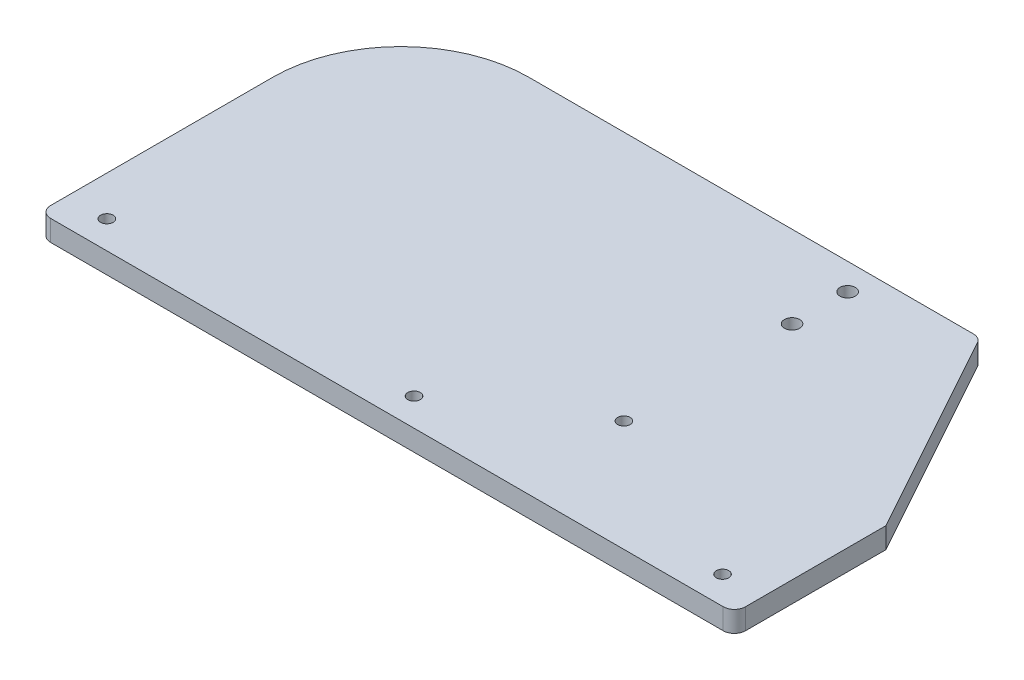
from build123d import *

# Parameters (mm, degrees)
SKETCH1_R           = 2.25
SKETCH1_R_2         = 2.75
BOSS_EXTRUDE1_DEPTH = 7.5


with BuildPart() as part:
    # Sketch1 → Boss-Extrude1 (new body)
    with BuildSketch(Plane(origin=(0, 0, 0), x_dir=(1, 0, 0), z_dir=(0, 1, 0))):
        with BuildLine():
            Line((-166.25, -10), (75.75, -10))
            ThreePointArc((75.75, -10), (78.578427125, -8.828427125), (79.75, -6))
            Line((79.75, -6), (79.75, 44.5))
            Line((79.75, 44.5), (39.252647377, 117.931699085))
            ThreePointArc((39.252647377, 117.931699085), (37.783863769, 119.444328406), (35.75, 120))
            Line((35.75, 120), (-124.25, 120))
            ThreePointArc((-124.25, 120), (-156.776911935, 106.526911935), (-170.25, 74))
            Line((-170.25, 74), (-170.25, -6))
            ThreePointArc((-170.25, -6), (-169.078427125, -8.828427125), (-166.25, -10))
        make_face()
        with Locations((65.5, 0)):
            Circle(SKETCH1_R, mode=Mode.SUBTRACT)
        with Locations((-45.5, 0)):
            Circle(SKETCH1_R, mode=Mode.SUBTRACT)
        with Locations((-156, 0)):
            Circle(SKETCH1_R, mode=Mode.SUBTRACT)
        with Locations((0, 90.5)):
            Circle(SKETCH1_R_2, mode=Mode.SUBTRACT)
        with Locations((0, 110.5)):
            Circle(SKETCH1_R_2, mode=Mode.SUBTRACT)
        with Locations((0, 30)):
            Circle(SKETCH1_R, mode=Mode.SUBTRACT)
    extrude(amount=BOSS_EXTRUDE1_DEPTH)


solid = part.part
